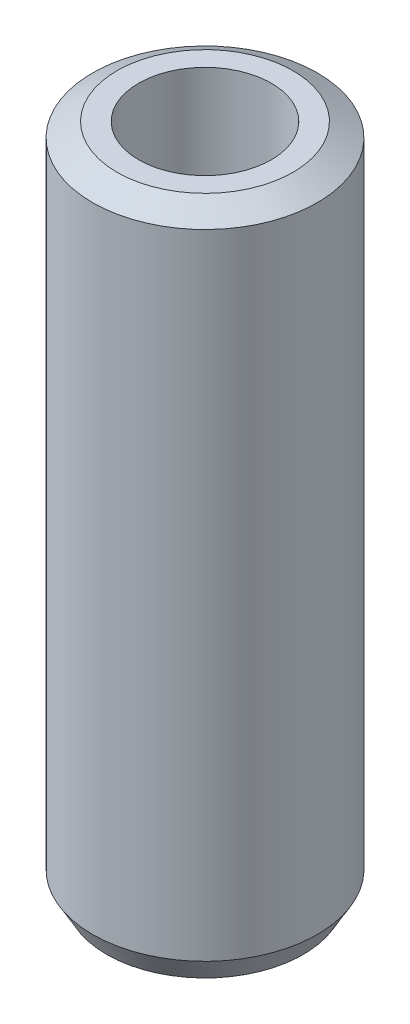
from build123d import *
from OCP.BRepFilletAPI import BRepFilletAPI_MakeChamfer

# Parameters (mm, degrees)
SKETCH1_R           = 27.5
BOSS_EXTRUDE1_DEPTH = 164.463908995
SKETCH2_R           = 16.233978633
CUT_EXTRUDE1_DEPTH  = 169.999637165
CHAMFER1_SIZE       = 3.444246375
CHAMFER1_SIZE2      = 5.965609715


with BuildPart() as part:
    # Sketch1 → Boss-Extrude1 (new body)
    with BuildSketch(Plane(origin=(0, 0, 0), x_dir=(1, 0, 0), z_dir=(0, 1, 0))):
        Circle(SKETCH1_R)
    extrude(amount=BOSS_EXTRUDE1_DEPTH)

    # Sketch2 → Cut-Extrude1 (cut, through all)
    with BuildSketch(Plane(origin=(0, 0, 0), x_dir=(1, 0, 0), z_dir=(0, 1, 0))):
        Circle(SKETCH2_R)
    extrude(amount=CUT_EXTRUDE1_DEPTH, mode=Mode.SUBTRACT)

    # Chamfer1: one chamfer whose edges measure the first distance from different faces: ONE call of the kernel's chamfer builder (chamfer() names one face for all edges)
    chamfer1_edges_1 = [part.edges().sort_by_distance(p)[0] for p in [
        (-27.5, 164.463908995, 0),
    ]]
    chamfer1_side_1 = [part.faces().sort_by_distance(p)[0] for p in [
        (-27.5, 82.231954498, 0),
    ]]
    chamfer1_edges_2 = [part.edges().sort_by_distance(p)[0] for p in [
        (-27.5, 0, 0),
    ]]
    chamfer1_side_2 = [part.faces().sort_by_distance(p)[0] for p in [
        (-26.722182541, 0, 0),
    ]]
    chamfer1 = BRepFilletAPI_MakeChamfer(part.part.solid().wrapped)
    for e in chamfer1_edges_1:
        chamfer1.Add(CHAMFER1_SIZE, CHAMFER1_SIZE2, e.wrapped, chamfer1_side_1[0].wrapped)  # the first distance lies on this face
    for e in chamfer1_edges_2:
        chamfer1.Add(CHAMFER1_SIZE, CHAMFER1_SIZE2, e.wrapped, chamfer1_side_2[0].wrapped)  # the first distance lies on this face
    add(Compound.cast(chamfer1.Shape()), mode=Mode.REPLACE)


solid = part.part
